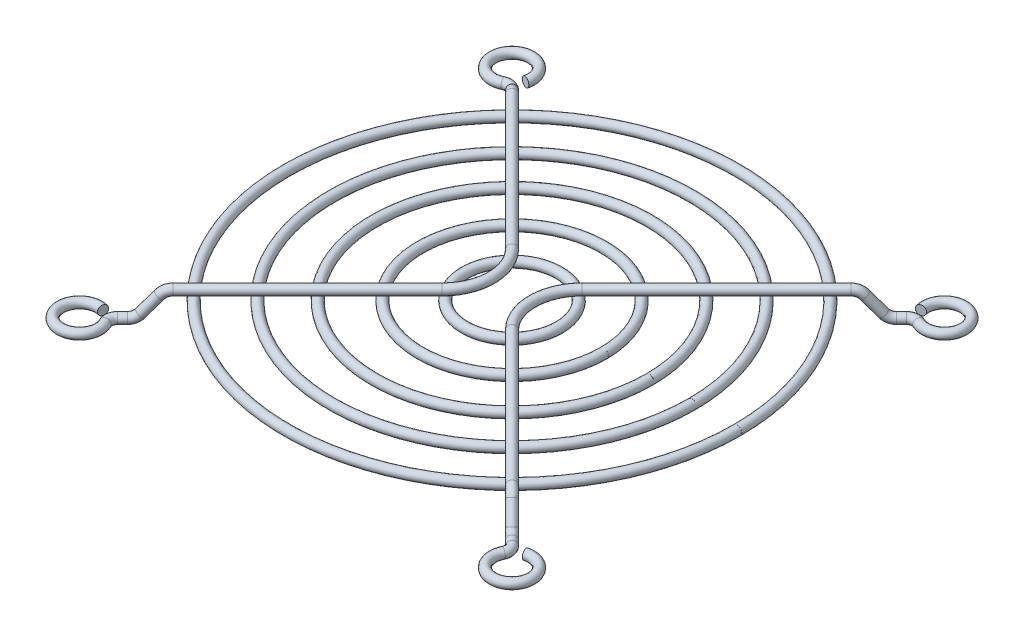
from build123d import *

# Parameters (mm, degrees)
BALAYAGE2_OUTLINE_R = 0.75
BALAYAGE2_ANGLE     = 359.984281
ESQUISSE4_R         = 0.75
ESQUISSE5_R         = 0.75
ESQUISSE7_R         = 0.75
ESQUISSE8_R         = 0.75
ESQUISSE11_R        = 0.75
ESQUISSE13_R        = 0.75
ESQUISSE19_R        = 0.75
ESQUISSE15_R        = 0.75
ESQUISSE20_R        = 0.75
ESQUISSE21_R        = 0.75


# Read off the part's stored shape, not the designer's step: Balayage2
with BuildPart() as part:
    # Balayage2 outline → Balayage2 (revolve)
    with BuildSketch(Plane.XY):
        with Locations((22.25, 0)):
            Circle(BALAYAGE2_OUTLINE_R)
        with Locations((29.15, 0)):
            Circle(BALAYAGE2_OUTLINE_R)
        with Locations((14.85, 0)):
            Circle(BALAYAGE2_OUTLINE_R)
        with Locations((36.45, 0)):
            Circle(BALAYAGE2_OUTLINE_R)
        with Locations((7.65, 0)):
            Circle(BALAYAGE2_OUTLINE_R)
    revolve(axis=Axis((0, 0, 0), (0, 1, 0)), revolution_arc=BALAYAGE2_ANGLE)


with BuildPart() as body_2:
    # Balayage3: sweep along a path in Esquisse3
    with BuildLine(Plane(origin=(0, 1.5, 0), x_dir=(-1, 0, 0), z_dir=(0, 1, 0))) as balayage3_path:
        Line((-27, -27), (-5.656854249, -5.656854249))
        ThreePointArc((-5.656854249, -5.656854249), (-3.313708499, 0), (-5.656854249, 5.656854249))
        Line((-5.656854249, 5.656854249), (-27, 27))
    # Esquisse4 → Balayage3 (sweep)
    with BuildSketch(Plane(origin=(27, 0, -27), x_dir=(-0.7071067811865488, 0, -0.7071067811865462), z_dir=(0.7071067811865462, 0, -0.7071067811865488))):
        with Locations((0, 1.5)):
            Circle(ESQUISSE4_R)
    sweep(path=balayage3_path.line)

    # Balayage14: sweep along a path in Esquisse9
    with BuildLine(Plane(origin=(0, 0, 0), x_dir=(0.7071067811865488, 0, -0.7071067811865462), z_dir=(0.7071067811865462, 0, 0.7071067811865488))) as balayage14_path:
        Line((38.183766184, 1.5), (38.822951605, 1.5))
        ThreePointArc((38.822951605, 1.5), (39.668188129, 1.312615574), (40.355040492, 0.785575219))
        Line((40.355040492, 0.785575219), (42.512491877, -1.785575219))
        ThreePointArc((42.512491877, -1.785575219), (43.199344239, -2.312615574), (44.044580763, -2.5))
        Line((44.044580763, -2.5), (44.683766184, -2.5))
    # Esquisse8 → Balayage14 (sweep)
    with BuildSketch(Plane(origin=(27, 0, -27), x_dir=(-0.7071067811865488, 0, -0.7071067811865462), z_dir=(0.7071067811865462, 0, -0.7071067811865488))):
        with Locations((0, 1.5)):
            Circle(ESQUISSE8_R)
    sweep(path=balayage14_path.line)

    # Balayage16: sweep along a path in Esquisse12
    with BuildLine(Plane(origin=(0, 0, 0), x_dir=(-0.7071067811865488, 0, -0.7071067811865462), z_dir=(0.7071067811865462, 0, -0.7071067811865488))) as balayage16_path:
        Line((-38.183766184, 1.5), (-38.822951605, 1.5))
        ThreePointArc((-38.822951605, 1.5), (-39.668188129, 1.312615574), (-40.355040492, 0.785575219))
        Line((-40.355040492, 0.785575219), (-42.512491877, -1.785575219))
        ThreePointArc((-42.512491877, -1.785575219), (-43.199344239, -2.312615574), (-44.044580763, -2.5))
        Line((-44.044580763, -2.5), (-44.683766184, -2.5))
    # Esquisse13 → Balayage16 (sweep)
    with BuildSketch(Plane(origin=(27, 0, 27), x_dir=(0.7071067811865457, 0, -0.7071067811865495), z_dir=(0.7071067811865495, 0, 0.7071067811865457))):
        with Locations((0, 1.5)):
            Circle(ESQUISSE13_R)
    sweep(path=balayage16_path.line)

    # Balayage18: sweep along a path in Esquisse16
    with BuildLine(Plane(origin=(0, -2.5, 0), x_dir=(-1, 0, 0), z_dir=(0, 1, 0))) as balayage18_path:
        Line((-31.596194078, 31.596194078), (-31.925101628, 31.925101628))
        ThreePointArc((-31.925101628, 31.925101628), (-32.343801875, 32.737784484), (-32.212993155, 33.642578604))
        ThreePointArc((-32.212993155, 33.642578604), (-36.972498721, 37.391495096), (-34.19766096, 32.005629939))
    # Esquisse19 → Balayage18 (sweep)
    with BuildSketch(Plane(origin=(31.596194078, 0, 31.596194078), x_dir=(0.7071067811865456, 0, -0.7071067811865495), z_dir=(0.7071067811865495, 0, 0.7071067811865456))):
        with Locations((0, -2.5)):
            Circle(ESQUISSE19_R)
    sweep(path=balayage18_path.line)

    # Balayage20: sweep along a path in Esquisse17
    with BuildLine(Plane(origin=(0, -2.5, 0), x_dir=(-1, 0, 0), z_dir=(0, 1, 0))) as balayage20_path:
        Line((-31.596194078, -31.596194078), (-31.925101628, -31.925101628))
        ThreePointArc((-31.925101628, -31.925101628), (-32.737784484, -32.343801875), (-33.642578604, -32.212993155))
        ThreePointArc((-33.642578604, -32.212993155), (-37.391495096, -36.972498721), (-32.005629939, -34.19766096))
    # Esquisse20 → Balayage20 (sweep)
    with BuildSketch(Plane(origin=(31.596194078, 0, -31.596194078), x_dir=(-0.7071067811865488, 0, -0.7071067811865462), z_dir=(0.7071067811865462, 0, -0.7071067811865488))):
        with Locations((0, -2.5)):
            Circle(ESQUISSE20_R)
    sweep(path=balayage20_path.line)


with BuildPart() as body_3:
    # Balayage6: sweep along a path in Esquisse3<5>
    with BuildLine(Plane(origin=(0, 1.5, 0), x_dir=(-1, 0, 0), z_dir=(0, 1, 0))) as balayage6_path:
        Line((27, 27), (5.656854249, 5.656854249))
        ThreePointArc((5.656854249, 5.656854249), (3.313708499, 0), (5.656854249, -5.656854249))
        Line((5.656854249, -5.656854249), (27, -27))
    # Esquisse5 → Balayage6 (sweep)
    with BuildSketch(Plane(origin=(-27, 0, -27), x_dir=(0.7071067811865488, 0, -0.7071067811865462), z_dir=(0.7071067811865462, 0, 0.7071067811865488))):
        with Locations((0, 1.5)):
            Circle(ESQUISSE5_R)
    sweep(path=balayage6_path.line)

    # Balayage8: sweep along a path in Esquisse6
    with BuildLine(Plane(origin=(0, 0, 0), x_dir=(0.7071067811865488, 0, -0.7071067811865462), z_dir=(0.7071067811865462, 0, 0.7071067811865488))) as balayage8_path:
        Line((-38.183766184, 1.5), (-38.822951605, 1.5))
        ThreePointArc((-38.822951605, 1.5), (-39.668188129, 1.312615574), (-40.355040492, 0.785575219))
        Line((-40.355040492, 0.785575219), (-42.512491877, -1.785575219))
        ThreePointArc((-42.512491877, -1.785575219), (-43.199344239, -2.312615574), (-44.044580763, -2.5))
        Line((-44.044580763, -2.5), (-44.683766184, -2.5))
    # Esquisse7 → Balayage8 (sweep)
    with BuildSketch(Plane(origin=(-27, 0, 27), x_dir=(0.7071067811865449, 0, 0.7071067811865502), z_dir=(-0.7071067811865502, 0, 0.7071067811865449))):
        with Locations((0, 1.5)):
            Circle(ESQUISSE7_R)
    sweep(path=balayage8_path.line)

    # Balayage15: sweep along a path in Esquisse10
    with BuildLine(Plane(origin=(0, 0, 0), x_dir=(-0.7071067811865488, 0, -0.7071067811865462), z_dir=(0.7071067811865462, 0, -0.7071067811865488))) as balayage15_path:
        Line((38.183766184, 1.5), (38.822951605, 1.5))
        ThreePointArc((38.822951605, 1.5), (39.668188129, 1.312615574), (40.355040492, 0.785575219))
        Line((40.355040492, 0.785575219), (42.512491877, -1.785575219))
        ThreePointArc((42.512491877, -1.785575219), (43.199344239, -2.312615574), (44.044580763, -2.5))
        Line((44.044580763, -2.5), (44.683766184, -2.5))
    # Esquisse11 → Balayage15 (sweep)
    with BuildSketch(Plane(origin=(-27, 0, -27), x_dir=(-0.7071067811865488, 0, 0.7071067811865462), z_dir=(-0.7071067811865462, 0, -0.7071067811865488))):
        with Locations((0, 1.5)):
            Circle(ESQUISSE11_R)
    sweep(path=balayage15_path.line)

    # Balayage19: sweep along a path in Esquisse14
    with BuildLine(Plane(origin=(0, -2.5, 0), x_dir=(-1, 0, 0), z_dir=(0, 1, 0))) as balayage19_path:
        Line((31.596194078, 31.596194078), (31.925101628, 31.925101628))
        ThreePointArc((31.925101628, 31.925101628), (32.343801875, 32.737784484), (32.212993155, 33.642578604))
        ThreePointArc((32.212993155, 33.642578604), (36.972498721, 37.391495096), (34.19766096, 32.005629939))
    # Esquisse15 → Balayage19 (sweep)
    with BuildSketch(Plane(origin=(-31.596194078, 0, 31.596194078), x_dir=(0.7071067811865449, 0, 0.7071067811865501), z_dir=(-0.7071067811865501, 0, 0.7071067811865449))):
        with Locations((0, -2.5)):
            Circle(ESQUISSE15_R)
    sweep(path=balayage19_path.line)

    # Balayage21: sweep along a path in Esquisse18
    with BuildLine(Plane(origin=(0, -2.5, 0), x_dir=(-1, 0, 0), z_dir=(0, 1, 0))) as balayage21_path:
        Line((31.596194078, -31.596194078), (31.925101628, -31.925101628))
        ThreePointArc((31.925101628, -31.925101628), (32.737784484, -32.343801875), (33.642578604, -32.212993155))
        ThreePointArc((33.642578604, -32.212993155), (37.391495096, -36.972498721), (32.005629939, -34.19766096))
    # Esquisse21 → Balayage21 (sweep)
    with BuildSketch(Plane(origin=(-31.596194078, 0, -31.596194078), x_dir=(-0.7071067811865488, 0, 0.7071067811865462), z_dir=(-0.7071067811865462, 0, -0.7071067811865488))):
        with Locations((0, -2.5)):
            Circle(ESQUISSE21_R)
    sweep(path=balayage21_path.line)


solid = Compound([part.part, body_2.part, body_3.part])
